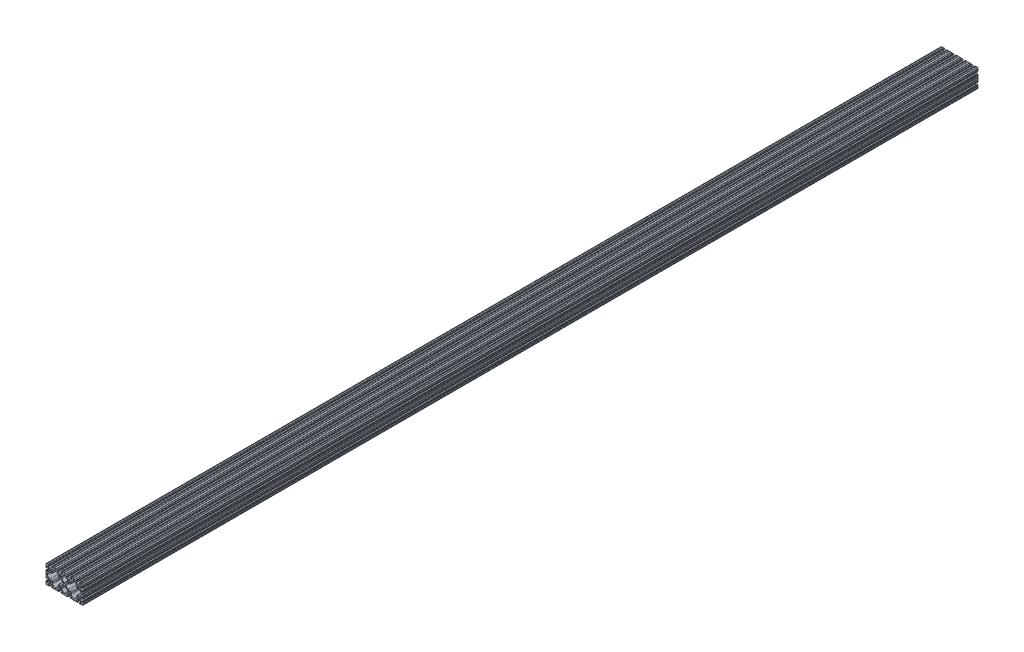
from build123d import *

# Parameters (mm, degrees)
SKETCH1_R      = 3.3274
EXTRUDE1_DEPTH = 3683


with BuildPart() as part:
    # Sketch1 → Extrude1 (new body)
    with BuildSketch(Plane.XY):
        with BuildLine():
            Line((-3.2004, -38.1), (3.2004, -38.1))
            ThreePointArc((3.2004, -38.1), (3.9624, -37.338), (4.7244, -38.1))
            Line((4.7244, -38.1), (9.5504, -38.1))
            ThreePointArc((9.5504, -38.1), (10.3124, -37.338), (11.0744, -38.1))
            Line((11.0744, -38.1), (13.4112, -38.1))
            ThreePointArc((13.4112, -38.1), (14.524751759, -37.638751759), (14.986, -36.5252))
            Line((14.986, -36.5252), (14.986, -35.6108))
            ThreePointArc((14.986, -35.6108), (14.524751759, -34.497248241), (13.4112, -34.036))
            Line((13.4112, -34.036), (9.652, -34.036))
            ThreePointArc((9.652, -34.036), (9.023382072, -33.775617928), (8.763, -33.147))
            Line((8.763, -33.147), (8.763, -32.578918))
            ThreePointArc((8.763, -32.578918), (8.830671096, -32.238712428), (9.023382072, -31.950300071))
            Line((9.023382072, -31.950300071), (13.794483168, -27.179198975))
            ThreePointArc((13.794483168, -27.179198975), (15.33542919, -26.14957176), (17.153098957, -25.788014764))
            Line((17.153098957, -25.788014764), (20.946901043, -25.788014764))
            ThreePointArc((20.946901043, -25.788014764), (22.76457081, -26.14957176), (24.305516832, -27.179198975))
            Line((24.305516832, -27.179198975), (29.076617928, -31.950300071))
            ThreePointArc((29.076617928, -31.950300071), (29.269328904, -32.238712428), (29.337, -32.578918))
            Line((29.337, -32.578918), (29.337, -33.147))
            ThreePointArc((29.337, -33.147), (29.076617928, -33.775617928), (28.448, -34.036))
            Line((28.448, -34.036), (24.6888, -34.036))
            ThreePointArc((24.6888, -34.036), (23.575248241, -34.497248241), (23.114, -35.6108))
            Line((23.114, -35.6108), (23.114, -36.5252))
            ThreePointArc((23.114, -36.5252), (23.575248241, -37.638751759), (24.6888, -38.1))
            Line((24.6888, -38.1), (27.0256, -38.1))
            ThreePointArc((27.0256, -38.1), (27.7876, -37.338), (28.5496, -38.1))
            Line((28.5496, -38.1), (33.3756, -38.1))
            ThreePointArc((33.3756, -38.1), (34.1376, -37.338), (34.8996, -38.1))
            Line((34.8996, -38.1), (41.3004, -38.1))
            ThreePointArc((41.3004, -38.1), (42.0624, -37.338), (42.8244, -38.1))
            Line((42.8244, -38.1), (47.6504, -38.1))
            ThreePointArc((47.6504, -38.1), (48.4124, -37.338), (49.1744, -38.1))
            Line((49.1744, -38.1), (51.5112, -38.1))
            ThreePointArc((51.5112, -38.1), (52.624751759, -37.638751759), (53.086, -36.5252))
            Line((53.086, -36.5252), (53.086, -35.6108))
            ThreePointArc((53.086, -35.6108), (52.624751759, -34.497248241), (51.5112, -34.036))
            Line((51.5112, -34.036), (47.752, -34.036))
            ThreePointArc((47.752, -34.036), (47.123382072, -33.775617928), (46.863, -33.147))
            Line((46.863, -33.147), (46.863, -32.578918))
            ThreePointArc((46.863, -32.578918), (46.930671096, -32.238712428), (47.123382072, -31.950300071))
            Line((47.123382072, -31.950300071), (51.894483168, -27.179198975))
            ThreePointArc((51.894483168, -27.179198975), (53.43542919, -26.14957176), (55.253098957, -25.788014764))
            Line((55.253098957, -25.788014764), (59.046901043, -25.788014764))
            ThreePointArc((59.046901043, -25.788014764), (60.86457081, -26.14957176), (62.405516832, -27.179198975))
            Line((62.405516832, -27.179198975), (67.176617928, -31.950300071))
            ThreePointArc((67.176617928, -31.950300071), (67.369328904, -32.238712428), (67.437, -32.578918))
            Line((67.437, -32.578918), (67.437, -33.147))
            ThreePointArc((67.437, -33.147), (67.176617928, -33.775617928), (66.548, -34.036))
            Line((66.548, -34.036), (62.7888, -34.036))
            ThreePointArc((62.7888, -34.036), (61.675248241, -34.497248241), (61.214, -35.6108))
            Line((61.214, -35.6108), (61.214, -36.5252))
            ThreePointArc((61.214, -36.5252), (61.675248241, -37.638751759), (62.7888, -38.1))
            Line((62.7888, -38.1), (65.1256, -38.1))
            ThreePointArc((65.1256, -38.1), (65.8876, -37.338), (66.6496, -38.1))
            Line((66.6496, -38.1), (71.4756, -38.1))
            ThreePointArc((71.4756, -38.1), (72.2376, -37.338), (72.9996, -38.1))
            Line((72.9996, -38.1), (73.025, -38.1))
            ThreePointArc((73.025, -38.1), (75.27006403, -37.17006403), (76.2, -34.925))
            Line((76.2, -34.925), (76.2, -34.8996))
            ThreePointArc((76.2, -34.8996), (75.438, -34.1376), (76.2, -33.3756))
            Line((76.2, -33.3756), (76.2, -28.5496))
            ThreePointArc((76.2, -28.5496), (75.438, -27.7876), (76.2, -27.0256))
            Line((76.2, -27.0256), (76.2, -24.6888))
            ThreePointArc((76.2, -24.6888), (75.738751759, -23.575248241), (74.6252, -23.114))
            Line((74.6252, -23.114), (73.7108, -23.114))
            ThreePointArc((73.7108, -23.114), (72.597248241, -23.575248241), (72.136, -24.6888))
            Line((72.136, -24.6888), (72.136, -28.448))
            ThreePointArc((72.136, -28.448), (71.875617928, -29.076617928), (71.247, -29.337))
            Line((71.247, -29.337), (70.678918, -29.337))
            ThreePointArc((70.678918, -29.337), (70.338712428, -29.269328904), (70.050300071, -29.076617928))
            Line((70.050300071, -29.076617928), (65.279198975, -24.305516832))
            ThreePointArc((65.279198975, -24.305516832), (64.24957176, -22.76457081), (63.888014764, -20.946901043))
            Line((63.888014764, -20.946901043), (63.888014764, -17.153098957))
            ThreePointArc((63.888014764, -17.153098957), (64.24957176, -15.33542919), (65.279198975, -13.794483168))
            Line((65.279198975, -13.794483168), (70.050300071, -9.023382072))
            ThreePointArc((70.050300071, -9.023382072), (70.338712428, -8.830671096), (70.678918, -8.763))
            Line((70.678918, -8.763), (71.247, -8.763))
            ThreePointArc((71.247, -8.763), (71.875617928, -9.023382072), (72.136, -9.652))
            Line((72.136, -9.652), (72.136, -13.4112))
            ThreePointArc((72.136, -13.4112), (72.597248241, -14.524751759), (73.7108, -14.986))
            Line((73.7108, -14.986), (74.6252, -14.986))
            ThreePointArc((74.6252, -14.986), (75.738751759, -14.524751759), (76.2, -13.4112))
            Line((76.2, -13.4112), (76.2, -11.0744))
            ThreePointArc((76.2, -11.0744), (75.438, -10.3124), (76.2, -9.5504))
            Line((76.2, -9.5504), (76.2, -4.7244))
            ThreePointArc((76.2, -4.7244), (75.438, -3.9624), (76.2, -3.2004))
            Line((76.2, -3.2004), (76.2, 3.2004))
            ThreePointArc((76.2, 3.2004), (75.438, 3.9624), (76.2, 4.7244))
            Line((76.2, 4.7244), (76.2, 9.5504))
            ThreePointArc((76.2, 9.5504), (75.438, 10.3124), (76.2, 11.0744))
            Line((76.2, 11.0744), (76.2, 13.4112))
            ThreePointArc((76.2, 13.4112), (75.738751759, 14.524751759), (74.6252, 14.986))
            Line((74.6252, 14.986), (73.7108, 14.986))
            ThreePointArc((73.7108, 14.986), (72.597248241, 14.524751759), (72.136, 13.4112))
            Line((72.136, 13.4112), (72.136, 9.652))
            ThreePointArc((72.136, 9.652), (71.875617928, 9.023382072), (71.247, 8.763))
            Line((71.247, 8.763), (70.678918, 8.763))
            ThreePointArc((70.678918, 8.763), (70.338712428, 8.830671096), (70.050300071, 9.023382072))
            Line((70.050300071, 9.023382072), (65.279198975, 13.794483168))
            ThreePointArc((65.279198975, 13.794483168), (64.24957176, 15.33542919), (63.888014764, 17.153098957))
            Line((63.888014764, 17.153098957), (63.888014764, 20.946901043))
            ThreePointArc((63.888014764, 20.946901043), (64.24957176, 22.76457081), (65.279198975, 24.305516832))
            Line((65.279198975, 24.305516832), (70.050300071, 29.076617928))
            ThreePointArc((70.050300071, 29.076617928), (70.338712428, 29.269328904), (70.678918, 29.337))
            Line((70.678918, 29.337), (71.247, 29.337))
            ThreePointArc((71.247, 29.337), (71.875617928, 29.076617928), (72.136, 28.448))
            Line((72.136, 28.448), (72.136, 24.6888))
            ThreePointArc((72.136, 24.6888), (72.597248241, 23.575248241), (73.7108, 23.114))
            Line((73.7108, 23.114), (74.6252, 23.114))
            ThreePointArc((74.6252, 23.114), (75.738751759, 23.575248241), (76.2, 24.6888))
            Line((76.2, 24.6888), (76.2, 27.0256))
            ThreePointArc((76.2, 27.0256), (75.438, 27.7876), (76.2, 28.5496))
            Line((76.2, 28.5496), (76.2, 33.3756))
            ThreePointArc((76.2, 33.3756), (75.438, 34.1376), (76.2, 34.8996))
            Line((76.2, 34.8996), (76.2, 34.925))
            ThreePointArc((76.2, 34.925), (75.27006403, 37.17006403), (73.025, 38.1))
            Line((73.025, 38.1), (72.9996, 38.1))
            ThreePointArc((72.9996, 38.1), (72.2376, 37.338), (71.4756, 38.1))
            Line((71.4756, 38.1), (66.6496, 38.1))
            ThreePointArc((66.6496, 38.1), (65.8876, 37.338), (65.1256, 38.1))
            Line((65.1256, 38.1), (62.7888, 38.1))
            ThreePointArc((62.7888, 38.1), (61.675248241, 37.638751759), (61.214, 36.5252))
            Line((61.214, 36.5252), (61.214, 35.6108))
            ThreePointArc((61.214, 35.6108), (61.675248241, 34.497248241), (62.7888, 34.036))
            Line((62.7888, 34.036), (66.548, 34.036))
            ThreePointArc((66.548, 34.036), (67.176617928, 33.775617928), (67.437, 33.147))
            Line((67.437, 33.147), (67.437, 32.578918))
            ThreePointArc((67.437, 32.578918), (67.369328904, 32.238712428), (67.176617928, 31.950300071))
            Line((67.176617928, 31.950300071), (62.405516832, 27.179198975))
            ThreePointArc((62.405516832, 27.179198975), (60.86457081, 26.14957176), (59.046901043, 25.788014764))
            Line((59.046901043, 25.788014764), (55.253098957, 25.788014764))
            ThreePointArc((55.253098957, 25.788014764), (53.43542919, 26.14957176), (51.894483168, 27.179198975))
            Line((51.894483168, 27.179198975), (47.123382072, 31.950300071))
            ThreePointArc((47.123382072, 31.950300071), (46.930671096, 32.238712428), (46.863, 32.578918))
            Line((46.863, 32.578918), (46.863, 33.147))
            ThreePointArc((46.863, 33.147), (47.123382072, 33.775617928), (47.752, 34.036))
            Line((47.752, 34.036), (51.5112, 34.036))
            ThreePointArc((51.5112, 34.036), (52.624751759, 34.497248241), (53.086, 35.6108))
            Line((53.086, 35.6108), (53.086, 36.5252))
            ThreePointArc((53.086, 36.5252), (52.624751759, 37.638751759), (51.5112, 38.1))
            Line((51.5112, 38.1), (49.1744, 38.1))
            ThreePointArc((49.1744, 38.1), (48.4124, 37.338), (47.6504, 38.1))
            Line((47.6504, 38.1), (42.8244, 38.1))
            ThreePointArc((42.8244, 38.1), (42.0624, 37.338), (41.3004, 38.1))
            Line((41.3004, 38.1), (34.8996, 38.1))
            ThreePointArc((34.8996, 38.1), (34.1376, 37.338), (33.3756, 38.1))
            Line((33.3756, 38.1), (28.5496, 38.1))
            ThreePointArc((28.5496, 38.1), (27.7876, 37.338), (27.0256, 38.1))
            Line((27.0256, 38.1), (24.6888, 38.1))
            ThreePointArc((24.6888, 38.1), (23.575248241, 37.638751759), (23.114, 36.5252))
            Line((23.114, 36.5252), (23.114, 35.6108))
            ThreePointArc((23.114, 35.6108), (23.575248241, 34.497248241), (24.6888, 34.036))
            Line((24.6888, 34.036), (28.448, 34.036))
            ThreePointArc((28.448, 34.036), (29.076617928, 33.775617928), (29.337, 33.147))
            Line((29.337, 33.147), (29.337, 32.578918))
            ThreePointArc((29.337, 32.578918), (29.269328904, 32.238712428), (29.076617928, 31.950300071))
            Line((29.076617928, 31.950300071), (24.305516832, 27.179198975))
            ThreePointArc((24.305516832, 27.179198975), (22.76457081, 26.14957176), (20.946901043, 25.788014764))
            Line((20.946901043, 25.788014764), (17.153098957, 25.788014764))
            ThreePointArc((17.153098957, 25.788014764), (15.33542919, 26.14957176), (13.794483168, 27.179198975))
            Line((13.794483168, 27.179198975), (9.023382072, 31.950300071))
            ThreePointArc((9.023382072, 31.950300071), (8.830671096, 32.238712428), (8.763, 32.578918))
            Line((8.763, 32.578918), (8.763, 33.147))
            ThreePointArc((8.763, 33.147), (9.023382072, 33.775617928), (9.652, 34.036))
            Line((9.652, 34.036), (13.4112, 34.036))
            ThreePointArc((13.4112, 34.036), (14.524751759, 34.497248241), (14.986, 35.6108))
            Line((14.986, 35.6108), (14.986, 36.5252))
            ThreePointArc((14.986, 36.5252), (14.524751759, 37.638751759), (13.4112, 38.1))
            Line((13.4112, 38.1), (11.0744, 38.1))
            ThreePointArc((11.0744, 38.1), (10.3124, 37.338), (9.5504, 38.1))
            Line((9.5504, 38.1), (4.7244, 38.1))
            ThreePointArc((4.7244, 38.1), (3.9624, 37.338), (3.2004, 38.1))
            Line((3.2004, 38.1), (-3.2004, 38.1))
            ThreePointArc((-3.2004, 38.1), (-3.9624, 37.338), (-4.7244, 38.1))
            Line((-4.7244, 38.1), (-9.5504, 38.1))
            ThreePointArc((-9.5504, 38.1), (-10.3124, 37.338), (-11.0744, 38.1))
            Line((-11.0744, 38.1), (-13.4112, 38.1))
            ThreePointArc((-13.4112, 38.1), (-14.524751759, 37.638751759), (-14.986, 36.5252))
            Line((-14.986, 36.5252), (-14.986, 35.6108))
            ThreePointArc((-14.986, 35.6108), (-14.524751759, 34.497248241), (-13.4112, 34.036))
            Line((-13.4112, 34.036), (-9.652, 34.036))
            ThreePointArc((-9.652, 34.036), (-9.023382072, 33.775617928), (-8.763, 33.147))
            Line((-8.763, 33.147), (-8.763, 32.578918))
            ThreePointArc((-8.763, 32.578918), (-8.830671096, 32.238712428), (-9.023382072, 31.950300071))
            Line((-9.023382072, 31.950300071), (-13.794483168, 27.179198975))
            ThreePointArc((-13.794483168, 27.179198975), (-15.33542919, 26.14957176), (-17.153098957, 25.788014764))
            Line((-17.153098957, 25.788014764), (-20.946901043, 25.788014764))
            ThreePointArc((-20.946901043, 25.788014764), (-22.76457081, 26.14957176), (-24.305516832, 27.179198975))
            Line((-24.305516832, 27.179198975), (-29.076617928, 31.950300071))
            ThreePointArc((-29.076617928, 31.950300071), (-29.269328904, 32.238712428), (-29.337, 32.578918))
            Line((-29.337, 32.578918), (-29.337, 33.147))
            ThreePointArc((-29.337, 33.147), (-29.076617928, 33.775617928), (-28.448, 34.036))
            Line((-28.448, 34.036), (-24.6888, 34.036))
            ThreePointArc((-24.6888, 34.036), (-23.575248241, 34.497248241), (-23.114, 35.6108))
            Line((-23.114, 35.6108), (-23.114, 36.5252))
            ThreePointArc((-23.114, 36.5252), (-23.575248241, 37.638751759), (-24.6888, 38.1))
            Line((-24.6888, 38.1), (-27.0256, 38.1))
            ThreePointArc((-27.0256, 38.1), (-27.7876, 37.338), (-28.5496, 38.1))
            Line((-28.5496, 38.1), (-33.3756, 38.1))
            ThreePointArc((-33.3756, 38.1), (-34.1376, 37.338), (-34.8996, 38.1))
            Line((-34.8996, 38.1), (-41.3004, 38.1))
            ThreePointArc((-41.3004, 38.1), (-42.0624, 37.338), (-42.8244, 38.1))
            Line((-42.8244, 38.1), (-47.6504, 38.1))
            ThreePointArc((-47.6504, 38.1), (-48.4124, 37.338), (-49.1744, 38.1))
            Line((-49.1744, 38.1), (-51.5112, 38.1))
            ThreePointArc((-51.5112, 38.1), (-52.624751759, 37.638751759), (-53.086, 36.5252))
            Line((-53.086, 36.5252), (-53.086, 35.6108))
            ThreePointArc((-53.086, 35.6108), (-52.624751759, 34.497248241), (-51.5112, 34.036))
            Line((-51.5112, 34.036), (-47.752, 34.036))
            ThreePointArc((-47.752, 34.036), (-47.123382072, 33.775617928), (-46.863, 33.147))
            Line((-46.863, 33.147), (-46.863, 32.578918))
            ThreePointArc((-46.863, 32.578918), (-46.930671096, 32.238712428), (-47.123382072, 31.950300071))
            Line((-47.123382072, 31.950300071), (-51.894483168, 27.179198975))
            ThreePointArc((-51.894483168, 27.179198975), (-53.43542919, 26.14957176), (-55.253098957, 25.788014764))
            Line((-55.253098957, 25.788014764), (-59.046901043, 25.788014764))
            ThreePointArc((-59.046901043, 25.788014764), (-60.86457081, 26.14957176), (-62.405516832, 27.179198975))
            Line((-62.405516832, 27.179198975), (-67.176617928, 31.950300071))
            ThreePointArc((-67.176617928, 31.950300071), (-67.369328904, 32.238712428), (-67.437, 32.578918))
            Line((-67.437, 32.578918), (-67.437, 33.147))
            ThreePointArc((-67.437, 33.147), (-67.176617928, 33.775617928), (-66.548, 34.036))
            Line((-66.548, 34.036), (-62.7888, 34.036))
            ThreePointArc((-62.7888, 34.036), (-61.675248241, 34.497248241), (-61.214, 35.6108))
            Line((-61.214, 35.6108), (-61.214, 36.5252))
            ThreePointArc((-61.214, 36.5252), (-61.675248241, 37.638751759), (-62.7888, 38.1))
            Line((-62.7888, 38.1), (-65.1256, 38.1))
            ThreePointArc((-65.1256, 38.1), (-65.8876, 37.338), (-66.6496, 38.1))
            Line((-66.6496, 38.1), (-71.4756, 38.1))
            ThreePointArc((-71.4756, 38.1), (-72.2376, 37.338), (-72.9996, 38.1))
            Line((-72.9996, 38.1), (-73.025, 38.1))
            ThreePointArc((-73.025, 38.1), (-75.27006403, 37.17006403), (-76.2, 34.925))
            Line((-76.2, 34.925), (-76.2, 34.8996))
            ThreePointArc((-76.2, 34.8996), (-75.438, 34.1376), (-76.2, 33.3756))
            Line((-76.2, 33.3756), (-76.2, 28.5496))
            ThreePointArc((-76.2, 28.5496), (-75.438, 27.7876), (-76.2, 27.0256))
            Line((-76.2, 27.0256), (-76.2, 24.6888))
            ThreePointArc((-76.2, 24.6888), (-75.738751759, 23.575248241), (-74.6252, 23.114))
            Line((-74.6252, 23.114), (-73.7108, 23.114))
            ThreePointArc((-73.7108, 23.114), (-72.597248241, 23.575248241), (-72.136, 24.6888))
            Line((-72.136, 24.6888), (-72.136, 28.448))
            ThreePointArc((-72.136, 28.448), (-71.875617928, 29.076617928), (-71.247, 29.337))
            Line((-71.247, 29.337), (-70.678918, 29.337))
            ThreePointArc((-70.678918, 29.337), (-70.338712428, 29.269328904), (-70.050300071, 29.076617928))
            Line((-70.050300071, 29.076617928), (-65.279198975, 24.305516832))
            ThreePointArc((-65.279198975, 24.305516832), (-64.24957176, 22.76457081), (-63.888014764, 20.946901043))
            Line((-63.888014764, 20.946901043), (-63.888014764, 17.153098957))
            ThreePointArc((-63.888014764, 17.153098957), (-64.24957176, 15.33542919), (-65.279198975, 13.794483168))
            Line((-65.279198975, 13.794483168), (-70.050300071, 9.023382072))
            ThreePointArc((-70.050300071, 9.023382072), (-70.338712428, 8.830671096), (-70.678918, 8.763))
            Line((-70.678918, 8.763), (-71.247, 8.763))
            ThreePointArc((-71.247, 8.763), (-71.875617928, 9.023382072), (-72.136, 9.652))
            Line((-72.136, 9.652), (-72.136, 13.4112))
            ThreePointArc((-72.136, 13.4112), (-72.597248241, 14.524751759), (-73.7108, 14.986))
            Line((-73.7108, 14.986), (-74.6252, 14.986))
            ThreePointArc((-74.6252, 14.986), (-75.738751759, 14.524751759), (-76.2, 13.4112))
            Line((-76.2, 13.4112), (-76.2, 11.0744))
            ThreePointArc((-76.2, 11.0744), (-75.438, 10.3124), (-76.2, 9.5504))
            Line((-76.2, 9.5504), (-76.2, 4.7244))
            ThreePointArc((-76.2, 4.7244), (-75.438, 3.9624), (-76.2, 3.2004))
            Line((-76.2, 3.2004), (-76.2, -3.2004))
            ThreePointArc((-76.2, -3.2004), (-75.438, -3.9624), (-76.2, -4.7244))
            Line((-76.2, -4.7244), (-76.2, -9.5504))
            ThreePointArc((-76.2, -9.5504), (-75.438, -10.3124), (-76.2, -11.0744))
            Line((-76.2, -11.0744), (-76.2, -13.4112))
            ThreePointArc((-76.2, -13.4112), (-75.738751759, -14.524751759), (-74.6252, -14.986))
            Line((-74.6252, -14.986), (-73.7108, -14.986))
            ThreePointArc((-73.7108, -14.986), (-72.597248241, -14.524751759), (-72.136, -13.4112))
            Line((-72.136, -13.4112), (-72.136, -9.652))
            ThreePointArc((-72.136, -9.652), (-71.875617928, -9.023382072), (-71.247, -8.763))
            Line((-71.247, -8.763), (-70.678918, -8.763))
            ThreePointArc((-70.678918, -8.763), (-70.338712428, -8.830671096), (-70.050300071, -9.023382072))
            Line((-70.050300071, -9.023382072), (-65.279198975, -13.794483168))
            ThreePointArc((-65.279198975, -13.794483168), (-64.24957176, -15.33542919), (-63.888014764, -17.153098957))
            Line((-63.888014764, -17.153098957), (-63.888014764, -20.946901043))
            ThreePointArc((-63.888014764, -20.946901043), (-64.24957176, -22.76457081), (-65.279198975, -24.305516832))
            Line((-65.279198975, -24.305516832), (-70.050300071, -29.076617928))
            ThreePointArc((-70.050300071, -29.076617928), (-70.338712428, -29.269328904), (-70.678918, -29.337))
            Line((-70.678918, -29.337), (-71.247, -29.337))
            ThreePointArc((-71.247, -29.337), (-71.875617928, -29.076617928), (-72.136, -28.448))
            Line((-72.136, -28.448), (-72.136, -24.6888))
            ThreePointArc((-72.136, -24.6888), (-72.597248241, -23.575248241), (-73.7108, -23.114))
            Line((-73.7108, -23.114), (-74.6252, -23.114))
            ThreePointArc((-74.6252, -23.114), (-75.738751759, -23.575248241), (-76.2, -24.6888))
            Line((-76.2, -24.6888), (-76.2, -27.0256))
            ThreePointArc((-76.2, -27.0256), (-75.438, -27.7876), (-76.2, -28.5496))
            Line((-76.2, -28.5496), (-76.2, -33.3756))
            ThreePointArc((-76.2, -33.3756), (-75.438, -34.1376), (-76.2, -34.8996))
            Line((-76.2, -34.8996), (-76.2, -34.925))
            ThreePointArc((-76.2, -34.925), (-75.27006403, -37.17006403), (-73.025, -38.1))
            Line((-73.025, -38.1), (-72.9996, -38.1))
            ThreePointArc((-72.9996, -38.1), (-72.2376, -37.338), (-71.4756, -38.1))
            Line((-71.4756, -38.1), (-66.6496, -38.1))
            ThreePointArc((-66.6496, -38.1), (-65.8876, -37.338), (-65.1256, -38.1))
            Line((-65.1256, -38.1), (-62.7888, -38.1))
            ThreePointArc((-62.7888, -38.1), (-61.675248241, -37.638751759), (-61.214, -36.5252))
            Line((-61.214, -36.5252), (-61.214, -35.6108))
            ThreePointArc((-61.214, -35.6108), (-61.675248241, -34.497248241), (-62.7888, -34.036))
            Line((-62.7888, -34.036), (-66.548, -34.036))
            ThreePointArc((-66.548, -34.036), (-67.176617928, -33.775617928), (-67.437, -33.147))
            Line((-67.437, -33.147), (-67.437, -32.578918))
            ThreePointArc((-67.437, -32.578918), (-67.369328904, -32.238712428), (-67.176617928, -31.950300071))
            Line((-67.176617928, -31.950300071), (-62.405516832, -27.179198975))
            ThreePointArc((-62.405516832, -27.179198975), (-60.86457081, -26.14957176), (-59.046901043, -25.788014764))
            Line((-59.046901043, -25.788014764), (-55.253098957, -25.788014764))
            ThreePointArc((-55.253098957, -25.788014764), (-53.43542919, -26.14957176), (-51.894483168, -27.179198975))
            Line((-51.894483168, -27.179198975), (-47.123382072, -31.950300071))
            ThreePointArc((-47.123382072, -31.950300071), (-46.930671096, -32.238712428), (-46.863, -32.578918))
            Line((-46.863, -32.578918), (-46.863, -33.147))
            ThreePointArc((-46.863, -33.147), (-47.123382072, -33.775617928), (-47.752, -34.036))
            Line((-47.752, -34.036), (-51.5112, -34.036))
            ThreePointArc((-51.5112, -34.036), (-52.624751759, -34.497248241), (-53.086, -35.6108))
            Line((-53.086, -35.6108), (-53.086, -36.5252))
            ThreePointArc((-53.086, -36.5252), (-52.624751759, -37.638751759), (-51.5112, -38.1))
            Line((-51.5112, -38.1), (-49.1744, -38.1))
            ThreePointArc((-49.1744, -38.1), (-48.4124, -37.338), (-47.6504, -38.1))
            Line((-47.6504, -38.1), (-42.8244, -38.1))
            ThreePointArc((-42.8244, -38.1), (-42.0624, -37.338), (-41.3004, -38.1))
            Line((-41.3004, -38.1), (-34.8996, -38.1))
            ThreePointArc((-34.8996, -38.1), (-34.1376, -37.338), (-33.3756, -38.1))
            Line((-33.3756, -38.1), (-28.5496, -38.1))
            ThreePointArc((-28.5496, -38.1), (-27.7876, -37.338), (-27.0256, -38.1))
            Line((-27.0256, -38.1), (-24.6888, -38.1))
            ThreePointArc((-24.6888, -38.1), (-23.575248241, -37.638751759), (-23.114, -36.5252))
            Line((-23.114, -36.5252), (-23.114, -35.6108))
            ThreePointArc((-23.114, -35.6108), (-23.575248241, -34.497248241), (-24.6888, -34.036))
            Line((-24.6888, -34.036), (-28.448, -34.036))
            ThreePointArc((-28.448, -34.036), (-29.076617928, -33.775617928), (-29.337, -33.147))
            Line((-29.337, -33.147), (-29.337, -32.578918))
            ThreePointArc((-29.337, -32.578918), (-29.269328904, -32.238712428), (-29.076617928, -31.950300071))
            Line((-29.076617928, -31.950300071), (-24.305516832, -27.179198975))
            ThreePointArc((-24.305516832, -27.179198975), (-22.76457081, -26.14957176), (-20.946901043, -25.788014764))
            Line((-20.946901043, -25.788014764), (-17.153098957, -25.788014764))
            ThreePointArc((-17.153098957, -25.788014764), (-15.33542919, -26.14957176), (-13.794483168, -27.179198975))
            Line((-13.794483168, -27.179198975), (-9.023382072, -31.950300071))
            ThreePointArc((-9.023382072, -31.950300071), (-8.830671096, -32.238712428), (-8.763, -32.578918))
            Line((-8.763, -32.578918), (-8.763, -33.147))
            ThreePointArc((-8.763, -33.147), (-9.023382072, -33.775617928), (-9.652, -34.036))
            Line((-9.652, -34.036), (-13.4112, -34.036))
            ThreePointArc((-13.4112, -34.036), (-14.524751759, -34.497248241), (-14.986, -35.6108))
            Line((-14.986, -35.6108), (-14.986, -36.5252))
            ThreePointArc((-14.986, -36.5252), (-14.524751759, -37.638751759), (-13.4112, -38.1))
            Line((-13.4112, -38.1), (-11.0744, -38.1))
            ThreePointArc((-11.0744, -38.1), (-10.3124, -37.338), (-9.5504, -38.1))
            Line((-9.5504, -38.1), (-4.7244, -38.1))
            ThreePointArc((-4.7244, -38.1), (-3.9624, -37.338), (-3.2004, -38.1))
        make_face()
        with Locations((-19.05, -19.05)):
            Circle(SKETCH1_R, mode=Mode.SUBTRACT)
        with Locations((-57.15, 19.05)):
            Circle(SKETCH1_R, mode=Mode.SUBTRACT)
        with Locations((57.15, -19.05)):
            Circle(SKETCH1_R, mode=Mode.SUBTRACT)
        with Locations((19.05, 19.05)):
            Circle(SKETCH1_R, mode=Mode.SUBTRACT)
        with Locations((19.05, -19.05)):
            Circle(SKETCH1_R, mode=Mode.SUBTRACT)
        with Locations((57.15, 19.05)):
            Circle(SKETCH1_R, mode=Mode.SUBTRACT)
        with Locations((-57.15, -19.05)):
            Circle(SKETCH1_R, mode=Mode.SUBTRACT)
        with Locations((-19.05, 19.05)):
            Circle(SKETCH1_R, mode=Mode.SUBTRACT)
        with BuildLine():
            Line((-2.065458908, -33.160858949), (-10.920801025, -24.305516832))
            ThreePointArc((-10.920801025, -24.305516832), (-11.95042824, -22.76457081), (-12.311985236, -20.946901043))
            Line((-12.311985236, -20.946901043), (-12.311985236, -17.153098957))
            ThreePointArc((-12.311985236, -17.153098957), (-11.95042824, -15.33542919), (-10.920801025, -13.794483168))
            Line((-10.920801025, -13.794483168), (-2.065458908, -4.939141051))
            ThreePointArc((-2.065458908, -4.939141051), (0, -4.083599959), (2.065458908, -4.939141051))
            Line((2.065458908, -4.939141051), (10.920801025, -13.794483168))
            ThreePointArc((10.920801025, -13.794483168), (11.95042824, -15.33542919), (12.311985236, -17.153098957))
            Line((12.311985236, -17.153098957), (12.311985236, -20.946901043))
            ThreePointArc((12.311985236, -20.946901043), (11.95042824, -22.76457081), (10.920801025, -24.305516832))
            Line((10.920801025, -24.305516832), (2.065458908, -33.160858949))
            ThreePointArc((2.065458908, -33.160858949), (0, -34.016400041), (-2.065458908, -33.160858949))
        make_face(mode=Mode.SUBTRACT)
        with BuildLine():
            Line((22.61301458, -12.311985236), (17.153098957, -12.311985236))
            ThreePointArc((17.153098957, -12.311985236), (15.33542919, -11.95042824), (13.794483168, -10.920801025))
            Line((13.794483168, -10.920801025), (4.939141051, -2.065458908))
            ThreePointArc((4.939141051, -2.065458908), (4.083599959, 0), (4.939141051, 2.065458908))
            Line((4.939141051, 2.065458908), (13.794483168, 10.920801025))
            ThreePointArc((13.794483168, 10.920801025), (15.33542919, 11.95042824), (17.153098957, 12.311985236))
            Line((17.153098957, 12.311985236), (22.61301458, 12.311985236))
            ThreePointArc((22.61301458, 12.311985236), (24.85807861, 13.241921206), (25.78801458, 15.486985236))
            Line((25.78801458, 15.486985236), (25.78801458, 20.946901043))
            ThreePointArc((25.78801458, 20.946901043), (26.149571576, 22.76457081), (27.179198791, 24.305516832))
            Line((27.179198791, 24.305516832), (36.034541092, 33.160859133))
            ThreePointArc((36.034541092, 33.160859133), (38.1, 34.016400226), (40.165458908, 33.160859133))
            Line((40.165458908, 33.160859133), (49.020801209, 24.305516832))
            ThreePointArc((49.020801209, 24.305516832), (50.050428424, 22.76457081), (50.41198542, 20.946901043))
            Line((50.41198542, 20.946901043), (50.41198542, 15.486985236))
            ThreePointArc((50.41198542, 15.486985236), (51.34192139, 13.241921206), (53.58698542, 12.311985236))
            Line((53.58698542, 12.311985236), (59.046901043, 12.311985236))
            ThreePointArc((59.046901043, 12.311985236), (60.86457081, 11.95042824), (62.405516832, 10.920801025))
            Line((62.405516832, 10.920801025), (71.260858949, 2.065458908))
            ThreePointArc((71.260858949, 2.065458908), (72.116400041, 0), (71.260858949, -2.065458908))
            Line((71.260858949, -2.065458908), (62.405516832, -10.920801025))
            ThreePointArc((62.405516832, -10.920801025), (60.86457081, -11.95042824), (59.046901043, -12.311985236))
            Line((59.046901043, -12.311985236), (53.58698542, -12.311985236))
            ThreePointArc((53.58698542, -12.311985236), (51.34192139, -13.241921206), (50.41198542, -15.486985236))
            Line((50.41198542, -15.486985236), (50.41198542, -20.946901043))
            ThreePointArc((50.41198542, -20.946901043), (50.050428424, -22.76457081), (49.020801209, -24.305516832))
            Line((49.020801209, -24.305516832), (40.165458908, -33.160859133))
            ThreePointArc((40.165458908, -33.160859133), (38.1, -34.016400226), (36.034541092, -33.160859133))
            Line((36.034541092, -33.160859133), (27.179198791, -24.305516832))
            ThreePointArc((27.179198791, -24.305516832), (26.149571576, -22.76457081), (25.78801458, -20.946901043))
            Line((25.78801458, -20.946901043), (25.78801458, -15.486985236))
            ThreePointArc((25.78801458, -15.486985236), (24.85807861, -13.241921206), (22.61301458, -12.311985236))
        make_face(mode=Mode.SUBTRACT)
        with BuildLine():
            Line((2.065458908, 33.160858949), (10.920801025, 24.305516832))
            ThreePointArc((10.920801025, 24.305516832), (11.95042824, 22.76457081), (12.311985236, 20.946901043))
            Line((12.311985236, 20.946901043), (12.311985236, 17.153098957))
            ThreePointArc((12.311985236, 17.153098957), (11.95042824, 15.33542919), (10.920801025, 13.794483168))
            Line((10.920801025, 13.794483168), (2.065458908, 4.939141051))
            ThreePointArc((2.065458908, 4.939141051), (0, 4.083599959), (-2.065458908, 4.939141051))
            Line((-2.065458908, 4.939141051), (-10.920801025, 13.794483168))
            ThreePointArc((-10.920801025, 13.794483168), (-11.95042824, 15.33542919), (-12.311985236, 17.153098957))
            Line((-12.311985236, 17.153098957), (-12.311985236, 20.946901043))
            ThreePointArc((-12.311985236, 20.946901043), (-11.95042824, 22.76457081), (-10.920801025, 24.305516832))
            Line((-10.920801025, 24.305516832), (-2.065458908, 33.160858949))
            ThreePointArc((-2.065458908, 33.160858949), (0, 34.016400041), (2.065458908, 33.160858949))
        make_face(mode=Mode.SUBTRACT)
        with BuildLine():
            Line((-53.58698542, -12.311985236), (-59.046901043, -12.311985236))
            ThreePointArc((-59.046901043, -12.311985236), (-60.86457081, -11.95042824), (-62.405516832, -10.920801025))
            Line((-62.405516832, -10.920801025), (-71.260858949, -2.065458908))
            ThreePointArc((-71.260858949, -2.065458908), (-72.116400041, 0), (-71.260858949, 2.065458908))
            Line((-71.260858949, 2.065458908), (-62.405516832, 10.920801025))
            ThreePointArc((-62.405516832, 10.920801025), (-60.86457081, 11.95042824), (-59.046901043, 12.311985236))
            Line((-59.046901043, 12.311985236), (-53.58698542, 12.311985236))
            ThreePointArc((-53.58698542, 12.311985236), (-51.34192139, 13.241921206), (-50.41198542, 15.486985236))
            Line((-50.41198542, 15.486985236), (-50.41198542, 20.946901043))
            ThreePointArc((-50.41198542, 20.946901043), (-50.050428424, 22.76457081), (-49.020801209, 24.305516832))
            Line((-49.020801209, 24.305516832), (-40.165458908, 33.160859133))
            ThreePointArc((-40.165458908, 33.160859133), (-38.1, 34.016400226), (-36.034541092, 33.160859133))
            Line((-36.034541092, 33.160859133), (-27.179198791, 24.305516832))
            ThreePointArc((-27.179198791, 24.305516832), (-26.149571576, 22.76457081), (-25.78801458, 20.946901043))
            Line((-25.78801458, 20.946901043), (-25.78801458, 15.486985236))
            ThreePointArc((-25.78801458, 15.486985236), (-24.85807861, 13.241921206), (-22.61301458, 12.311985236))
            Line((-22.61301458, 12.311985236), (-17.153098957, 12.311985236))
            ThreePointArc((-17.153098957, 12.311985236), (-15.33542919, 11.95042824), (-13.794483168, 10.920801025))
            Line((-13.794483168, 10.920801025), (-4.939141051, 2.065458908))
            ThreePointArc((-4.939141051, 2.065458908), (-4.083599959, 0), (-4.939141051, -2.065458908))
            Line((-4.939141051, -2.065458908), (-13.794483168, -10.920801025))
            ThreePointArc((-13.794483168, -10.920801025), (-15.33542919, -11.95042824), (-17.153098957, -12.311985236))
            Line((-17.153098957, -12.311985236), (-22.61301458, -12.311985236))
            ThreePointArc((-22.61301458, -12.311985236), (-24.85807861, -13.241921206), (-25.78801458, -15.486985236))
            Line((-25.78801458, -15.486985236), (-25.78801458, -20.946901043))
            ThreePointArc((-25.78801458, -20.946901043), (-26.149571576, -22.76457081), (-27.179198791, -24.305516832))
            Line((-27.179198791, -24.305516832), (-36.034541092, -33.160859133))
            ThreePointArc((-36.034541092, -33.160859133), (-38.1, -34.016400226), (-40.165458908, -33.160859133))
            Line((-40.165458908, -33.160859133), (-49.020801209, -24.305516832))
            ThreePointArc((-49.020801209, -24.305516832), (-50.050428424, -22.76457081), (-50.41198542, -20.946901043))
            Line((-50.41198542, -20.946901043), (-50.41198542, -15.486985236))
            ThreePointArc((-50.41198542, -15.486985236), (-51.34192139, -13.241921206), (-53.58698542, -12.311985236))
        make_face(mode=Mode.SUBTRACT)
    extrude(amount=-EXTRUDE1_DEPTH)


solid = part.part
